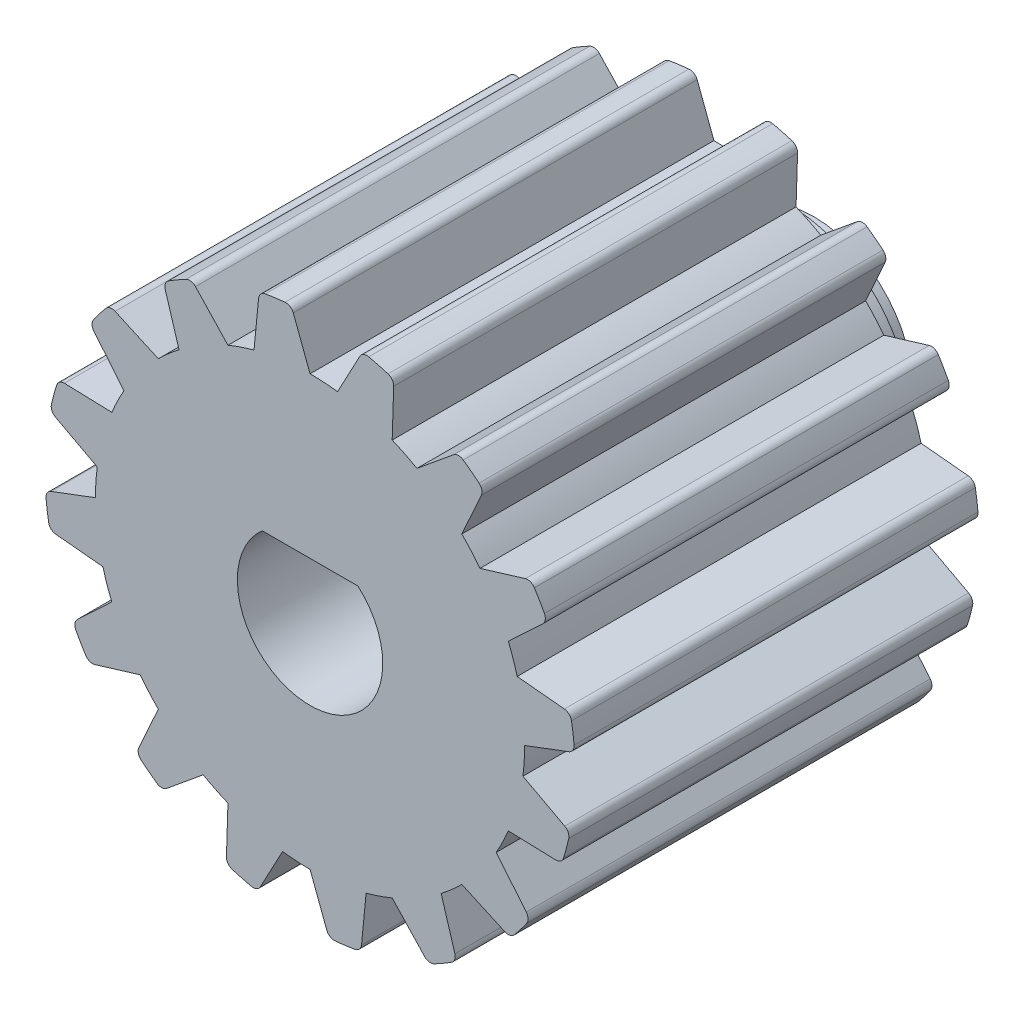
from build123d import *

# Parameters (mm, degrees)
SALIENTE_EXTRUIR1_DEPTH    = 15
CROQUIS5_R                 = 4.5
SALIENTE_EXTRUIR2_DEPTH    = 6
CORTAR_EXTRUIR1_DEPTH      = 26.166810333
ESCALA1_SCALE              = 1.5
CORTAR_EXTRUIR2_DEPTH      = 38.7502155
CORTAR_EXTRUIR2_DEPTH_BACK = 38.7502155
CORTAR_EXTRUIR3_DEPTH      = 38.7502155
CORTAR_EXTRUIR3_DEPTH_BACK = 5.8
CROQUIS7_R                 = 10
SALIENTE_EXTRUIR3_START    = 2.37
CROQUIS8_R                 = 5.5
SALIENTE_EXTRUIR3_DEPTH    = 2.37
CROQUIS9_R                 = 6.75
CROQUIS9_R_2               = 5.5
SALIENTE_EXTRUIR4_DEPTH    = 1


with BuildPart() as part:
    # Croquis2 → Saliente-Extruir1 (new body)
    with BuildSketch(Plane.XY):
        with BuildLine():
            Line((-2.081696937, 7.693567449), (-1.911179214, 9.445287663))
            ThreePointArc((-1.911179214, 9.445287663), (-1.831468139, 9.618345927), (-1.663611198, 9.708496165))
            ThreePointArc((-1.663611198, 9.708496165), (-1.297642615, 9.764149919), (-0.929841298, 9.806013214))
            ThreePointArc((-0.929841298, 9.806013214), (-0.744265019, 9.762833784), (-0.622120698, 9.616601835))
            Line((-0.622120698, 9.616601835), (0, 7.97022222))
            ThreePointArc((0, 7.97022222), (0.511536449, 7.953789832), (1.020963606, 7.904560428))
            Line((1.020963606, 7.904560428), (1.848855744, 9.457684572))
            ThreePointArc((1.848855744, 9.457684572), (1.988725705, 9.587065453), (2.1783043, 9.606117341))
            ThreePointArc((2.1783043, 9.606117341), (2.537712953, 9.517484592), (2.893537451, 9.415409764))
            ThreePointArc((2.893537451, 9.415409764), (3.048463524, 9.304500205), (3.105349619, 9.122656892))
            Line((3.105349619, 9.122656892), (3.050071996, 7.363525179))
            ThreePointArc((3.050071996, 7.363525179), (3.516381649, 7.152587108), (3.968191694, 6.912155736))
            Line((3.968191694, 6.912155736), (5.327419174, 8.030234739))
            ThreePointArc((5.327419174, 8.030234739), (5.506154088, 8.09624117), (5.688592714, 8.041294232))
            ThreePointArc((5.688592714, 8.041294232), (5.986724728, 7.821868513), (6.276401353, 7.591395527))
            ThreePointArc((6.276401353, 7.591395527), (6.37709113, 7.429640815), (6.360058606, 7.239870134))
            Line((6.360058606, 7.239870134), (5.635798179, 5.635798179))
            ThreePointArc((5.635798179, 5.635798179), (5.985889619, 5.262467835), (6.311298569, 4.867437992))
            Line((6.311298569, 4.867437992), (7.994931329, 5.380254461))
            ThreePointArc((7.994931329, 5.380254461), (8.185320425, 5.372837562), (8.332844455, 5.252256971))
            ThreePointArc((8.332844455, 5.252256971), (8.524311933, 4.935443857), (8.703740045, 4.611660138))
            ThreePointArc((8.703740045, 4.611660138), (8.73486442, 4.42368596), (8.646506324, 4.254878777))
            Line((8.646506324, 4.254878777), (7.363525179, 3.050071996))
            ThreePointArc((7.363525179, 3.050071996), (7.544100156, 2.571185538), (7.693567449, 2.081696937))
            Line((7.693567449, 2.081696937), (9.445287663, 1.911179214))
            ThreePointArc((9.445287663, 1.911179214), (9.618345927, 1.831468139), (9.708496165, 1.663611198))
            ThreePointArc((9.708496165, 1.663611198), (9.764149919, 1.297642615), (9.806013214, 0.929841298))
            ThreePointArc((9.806013214, 0.929841298), (9.762833784, 0.744265019), (9.616601835, 0.622120698))
            Line((9.616601835, 0.622120698), (7.97022222, 0))
            ThreePointArc((7.97022222, 0), (7.953789832, -0.511536449), (7.904560428, -1.020963606))
            Line((7.904560428, -1.020963606), (9.457684572, -1.848855744))
            ThreePointArc((9.457684572, -1.848855744), (9.587065453, -1.988725705), (9.606117341, -2.1783043))
            ThreePointArc((9.606117341, -2.1783043), (9.517484592, -2.537712953), (9.415409764, -2.893537451))
            ThreePointArc((9.415409764, -2.893537451), (9.304500205, -3.048463524), (9.122656892, -3.105349619))
            Line((9.122656892, -3.105349619), (7.363525179, -3.050071996))
            ThreePointArc((7.363525179, -3.050071996), (7.152587108, -3.516381649), (6.912155736, -3.968191694))
            Line((6.912155736, -3.968191694), (8.030234739, -5.327419174))
            ThreePointArc((8.030234739, -5.327419174), (8.09624117, -5.506154088), (8.041294232, -5.688592714))
            ThreePointArc((8.041294232, -5.688592714), (7.821868513, -5.986724728), (7.591395527, -6.276401353))
            ThreePointArc((7.591395527, -6.276401353), (7.429640815, -6.37709113), (7.239870134, -6.360058606))
            Line((7.239870134, -6.360058606), (5.635798179, -5.635798179))
            ThreePointArc((5.635798179, -5.635798179), (5.262467835, -5.985889619), (4.867437992, -6.311298569))
            Line((4.867437992, -6.311298569), (5.380254461, -7.994931329))
            ThreePointArc((5.380254461, -7.994931329), (5.372837562, -8.185320425), (5.252256971, -8.332844455))
            ThreePointArc((5.252256971, -8.332844455), (4.935443857, -8.524311933), (4.611660138, -8.703740045))
            ThreePointArc((4.611660138, -8.703740045), (4.42368596, -8.73486442), (4.254878777, -8.646506324))
            Line((4.254878777, -8.646506324), (3.050071996, -7.363525179))
            ThreePointArc((3.050071996, -7.363525179), (2.571185538, -7.544100156), (2.081696937, -7.693567449))
            Line((2.081696937, -7.693567449), (1.911179214, -9.445287663))
            ThreePointArc((1.911179214, -9.445287663), (1.831468139, -9.618345927), (1.663611198, -9.708496165))
            ThreePointArc((1.663611198, -9.708496165), (1.297642615, -9.764149919), (0.929841298, -9.806013214))
            ThreePointArc((0.929841298, -9.806013214), (0.744265019, -9.762833784), (0.622120698, -9.616601835))
            Line((0.622120698, -9.616601835), (0, -7.97022222))
            ThreePointArc((0, -7.97022222), (-0.511536449, -7.953789832), (-1.020963606, -7.904560428))
            Line((-1.020963606, -7.904560428), (-1.848855744, -9.457684572))
            ThreePointArc((-1.848855744, -9.457684572), (-1.988725705, -9.587065453), (-2.1783043, -9.606117341))
            ThreePointArc((-2.1783043, -9.606117341), (-2.537712953, -9.517484592), (-2.893537451, -9.415409764))
            ThreePointArc((-2.893537451, -9.415409764), (-3.048463524, -9.304500205), (-3.105349619, -9.122656892))
            Line((-3.105349619, -9.122656892), (-3.050071996, -7.363525179))
            ThreePointArc((-3.050071996, -7.363525179), (-3.516381649, -7.152587108), (-3.968191694, -6.912155736))
            Line((-3.968191694, -6.912155736), (-5.327419174, -8.030234739))
            ThreePointArc((-5.327419174, -8.030234739), (-5.506154088, -8.09624117), (-5.688592714, -8.041294232))
            ThreePointArc((-5.688592714, -8.041294232), (-5.986724728, -7.821868513), (-6.276401353, -7.591395527))
            ThreePointArc((-6.276401353, -7.591395527), (-6.37709113, -7.429640815), (-6.360058606, -7.239870134))
            Line((-6.360058606, -7.239870134), (-5.635798179, -5.635798179))
            ThreePointArc((-5.635798179, -5.635798179), (-5.985889619, -5.262467835), (-6.311298569, -4.867437992))
            Line((-6.311298569, -4.867437992), (-7.994931329, -5.380254461))
            ThreePointArc((-7.994931329, -5.380254461), (-8.185320425, -5.372837562), (-8.332844455, -5.252256971))
            ThreePointArc((-8.332844455, -5.252256971), (-8.524311933, -4.935443857), (-8.703740045, -4.611660138))
            ThreePointArc((-8.703740045, -4.611660138), (-8.73486442, -4.42368596), (-8.646506324, -4.254878777))
            Line((-8.646506324, -4.254878777), (-7.363525179, -3.050071996))
            ThreePointArc((-7.363525179, -3.050071996), (-7.544100156, -2.571185538), (-7.693567449, -2.081696937))
            Line((-7.693567449, -2.081696937), (-9.445287663, -1.911179214))
            ThreePointArc((-9.445287663, -1.911179214), (-9.618345927, -1.831468139), (-9.708496165, -1.663611198))
            ThreePointArc((-9.708496165, -1.663611198), (-9.764149919, -1.297642615), (-9.806013214, -0.929841298))
            ThreePointArc((-9.806013214, -0.929841298), (-9.762833784, -0.744265019), (-9.616601835, -0.622120698))
            Line((-9.616601835, -0.622120698), (-7.97022222, 0))
            ThreePointArc((-7.97022222, 0), (-7.953789832, 0.511536449), (-7.904560428, 1.020963606))
            Line((-7.904560428, 1.020963606), (-9.457684572, 1.848855744))
            ThreePointArc((-9.457684572, 1.848855744), (-9.587065453, 1.988725705), (-9.606117341, 2.1783043))
            ThreePointArc((-9.606117341, 2.1783043), (-9.517484592, 2.537712953), (-9.415409764, 2.893537451))
            ThreePointArc((-9.415409764, 2.893537451), (-9.304500205, 3.048463524), (-9.122656892, 3.105349619))
            Line((-9.122656892, 3.105349619), (-7.363525179, 3.050071996))
            ThreePointArc((-7.363525179, 3.050071996), (-7.152587108, 3.516381649), (-6.912155736, 3.968191694))
            Line((-6.912155736, 3.968191694), (-8.030234739, 5.327419174))
            ThreePointArc((-8.030234739, 5.327419174), (-8.09624117, 5.506154088), (-8.041294232, 5.688592714))
            ThreePointArc((-8.041294232, 5.688592714), (-7.821868513, 5.986724728), (-7.591395527, 6.276401353))
            ThreePointArc((-7.591395527, 6.276401353), (-7.429640815, 6.37709113), (-7.239870134, 6.360058606))
            Line((-7.239870134, 6.360058606), (-5.635798179, 5.635798179))
            ThreePointArc((-5.635798179, 5.635798179), (-5.262467835, 5.985889619), (-4.867437992, 6.311298569))
            Line((-4.867437992, 6.311298569), (-5.380254461, 7.994931329))
            ThreePointArc((-5.380254461, 7.994931329), (-5.372837562, 8.185320425), (-5.252256971, 8.332844455))
            ThreePointArc((-5.252256971, 8.332844455), (-4.935443857, 8.524311933), (-4.611660138, 8.703740045))
            ThreePointArc((-4.611660138, 8.703740045), (-4.42368596, 8.73486442), (-4.254878777, 8.646506324))
            Line((-4.254878777, 8.646506324), (-3.050071996, 7.363525179))
            ThreePointArc((-3.050071996, 7.363525179), (-2.571185538, 7.544100156), (-2.081696937, 7.693567449))
        make_face()
    extrude(amount=SALIENTE_EXTRUIR1_DEPTH)

    # Croquis5 → Saliente-Extruir2 (add)
    with BuildSketch(Plane(origin=(0, 0, 0), x_dir=(-1, 0, 0), z_dir=(0, 0, -1))):
        Circle(CROQUIS5_R)
    extrude(amount=SALIENTE_EXTRUIR2_DEPTH)

    # Croquis3 → Cortar-Extruir1 (cut, through all)
    with BuildSketch(Plane.XY.offset(15)):
        with BuildLine():
            Line((-1.496696362, 1.68), (1.496696362, 1.68))
            ThreePointArc((1.496696362, 1.68), (0, -2.25), (-1.496696362, 1.68))
        make_face()
    extrude(amount=-CORTAR_EXTRUIR1_DEPTH, mode=Mode.SUBTRACT)


with BuildPart() as part_1:
    # Escala1: scaled about (0, 0, 0)
    add(part.part.scale(ESCALA1_SCALE))

    # Croquis6 → Cortar-Extruir2 (cut, two sides: drawn at the far end of the back side and taken through both)
    with BuildSketch(Plane.XY.offset(22.5).offset(-CORTAR_EXTRUIR2_DEPTH_BACK)):
        with BuildLine():
            Line((2.664582519, 3.05), (-2.664582519, 3.05))
            ThreePointArc((-2.664582519, 3.05), (0, -4.05), (2.664582519, 3.05))
        make_face()
    extrude(amount=CORTAR_EXTRUIR2_DEPTH + CORTAR_EXTRUIR2_DEPTH_BACK, mode=Mode.SUBTRACT)

    # Croquis7 → Cortar-Extruir3 (cut, two sides: drawn at the far end of the back side and taken through both)
    with BuildSketch(Plane(origin=(0, 0, -9), x_dir=(-1, 0, 0), z_dir=(0, 0, -1)).offset(-CORTAR_EXTRUIR3_DEPTH_BACK)):
        Circle(CROQUIS7_R)
    extrude(amount=CORTAR_EXTRUIR3_DEPTH + CORTAR_EXTRUIR3_DEPTH_BACK, mode=Mode.SUBTRACT)

    # Croquis8 → Saliente-Extruir3 (add)
    with BuildSketch(Plane(origin=(0, 0, -3.2), x_dir=(-1, 0, 0), z_dir=(0, 0, -1)).offset(SALIENTE_EXTRUIR3_START)):
        Circle(CROQUIS8_R)
        with BuildLine():
            Line((-2.664582519, 3.05), (2.664582519, 3.05))
            ThreePointArc((2.664582519, 3.05), (0, -4.05), (-2.664582519, 3.05))
        make_face(mode=Mode.SUBTRACT)
    extrude(amount=-SALIENTE_EXTRUIR3_DEPTH)

    # Croquis9 → Saliente-Extruir4 (add)
    with BuildSketch(Plane(origin=(0, 0, -3.2), x_dir=(-1, 0, 0), z_dir=(0, 0, -1))):
        Circle(CROQUIS9_R)
        Circle(CROQUIS9_R_2, mode=Mode.SUBTRACT)
    extrude(amount=SALIENTE_EXTRUIR4_DEPTH)


solid = part_1.part
